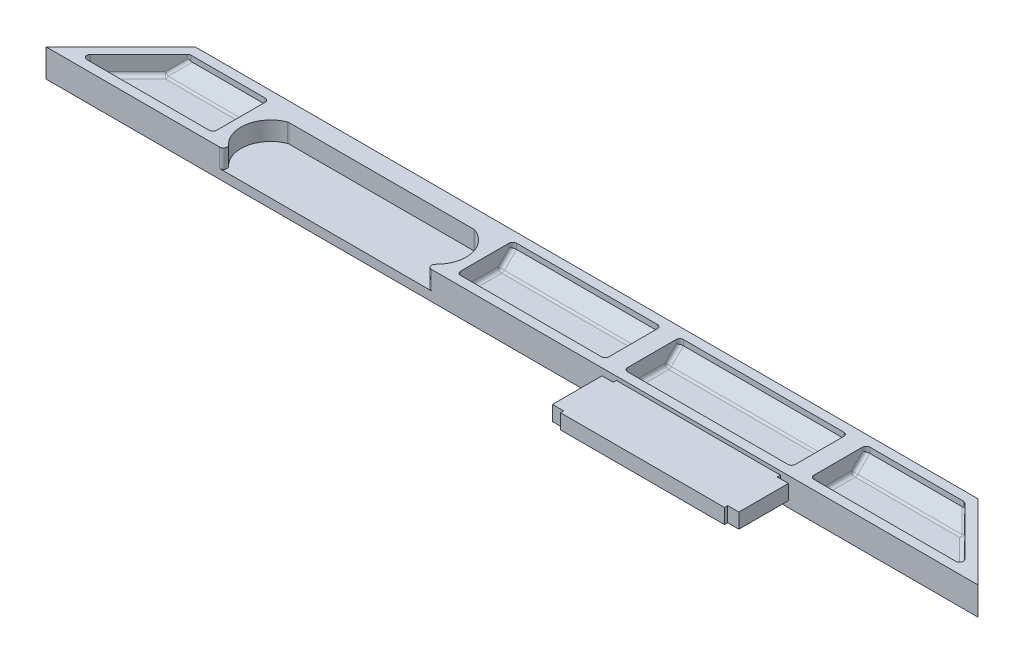
from build123d import *

# Parameters (mm, degrees)
BOSS_EXTRUDE1_DEPTH     = 3.75
SKETCH3_W               = 50
SKETCH3_H               = 15
BOSS_EXTRUDE3_DEPTH     = 4
CUT_EXTRUDE1_DEPTH      = 128.641098397
CUT_EXTRUDE1_DEPTH_BACK = 4
CHAMFER1_SIZE           = 5
SKETCH7_W               = 3
SKETCH7_H               = 0.853193318
CUT_EXTRUDE2_DEPTH      = 128.641098397
SHELL1_START            = -17.283882181
SHELL1_DEPTH            = 121.248348275
SHELL1_START_2          = -103.964466094
SHELL1_2_DEPTH          = 21.248348275
SHELL1_START_3          = -118.964466094
SHELL1_3_DEPTH          = 43.546786157
SHELL1_START_4          = -24.582320063
SHELL1_4_DEPTH          = 143.546786157
SHELL1_START_5          = -1.25
SHELL1_5_DEPTH          = 5
BOSS_EXTRUDE4_REACH     = 129.696
RIB1_REACH              = 129.696
SKETCH5_WALLS_W         = 5
SKETCH5_WALLS_H         = 272.391855782
FILLET1_R               = 1
FILLET3_R               = 1


with BuildPart() as part:
    # Sketch1 → Boss-Extrude1 (new, symmetric)
    with BuildSketch(Plane(origin=(0, 0, 0), x_dir=(1, 0, 0), z_dir=(0, 1, 0))):
        Polygon((-125, -10), (125, -10), (105, 10), (-105, 10), align=None)
    extrude(amount=BOSS_EXTRUDE1_DEPTH, both=True)

    # Sketch3 → Boss-Extrude3 (add)
    with BuildSketch(Plane(origin=(0, 2.75, 0), x_dir=(-1, 0, 0), z_dir=(0, 1, 0))):
        with Locations((-50, 17.5)):
            Rectangle(SKETCH3_W, SKETCH3_H)
    extrude(amount=-BOSS_EXTRUDE3_DEPTH)

    # Sketch4 → Cut-Extrude1 (cut, two sides: drawn at the far end of the back side and taken through both)
    with BuildSketch(Plane(origin=(0, 2.75, 0), x_dir=(-1, 0, 0), z_dir=(0, 1, 0)).offset(-CUT_EXTRUDE1_DEPTH_BACK)):
        with BuildLine():
            Line((75, 10), (25, 10))
            ThreePointArc((25, 10), (19.783882181, 2.5), (25, -5))
            Line((25, -5), (75, -5))
            ThreePointArc((75, -5), (80.216117819, 2.5), (75, 10))
        make_face()
    extrude(amount=CUT_EXTRUDE1_DEPTH + CUT_EXTRUDE1_DEPTH_BACK, mode=Mode.SUBTRACT)

    # Chamfer1
    chamfer1_edges = [part.edges().sort_by_distance(p)[0] for p in [
        (0, -3.75, -10),
    ]]
    chamfer(chamfer1_edges, length=CHAMFER1_SIZE)

    # Sketch7 → Cut-Extrude2 (cut, through all)
    with BuildSketch(Plane(origin=(0, 2.75, 0), x_dir=(-1, 0, 0), z_dir=(0, 1, 0))):
        with Locations((-73.5, 24.573403341)):
            Rectangle(SKETCH7_W, SKETCH7_H)
        with Locations((-73.5, 10.426596659)):
            Rectangle(SKETCH7_W, SKETCH7_H)
        with Locations((-26.5, 10.426596659)):
            Rectangle(SKETCH7_W, SKETCH7_H)
        with Locations((-26.5, 24.573403341)):
            Rectangle(SKETCH7_W, SKETCH7_H)
    extrude(amount=-CUT_EXTRUDE2_DEPTH, mode=Mode.SUBTRACT)

    # Shell1: read off the stored shape, not the designer's step
    # Shell1 outline → Shell1 (cut)
    with BuildSketch(Plane.YZ.offset(SHELL1_START)):
        Polygon((-1.25, 7.5), (-1.25, -3.964466094), (2.285533906, -7.5), (3.75, -7.5), (3.75, 7.5), align=None)
    extrude(amount=SHELL1_DEPTH, mode=Mode.SUBTRACT)

    # Shell1 2 outline → Shell1 2 (cut)
    with BuildSketch(Plane.YZ.offset(SHELL1_START_2)):
        Polygon((-1.25, 7.5), (-1.25, -3.964466094), (2.285533906, -7.5), (3.75, -7.5), (3.75, 7.5), align=None)
    extrude(amount=SHELL1_2_DEPTH, mode=Mode.SUBTRACT)

    # Shell1 3 outline → Shell1 3 (cut)
    with BuildSketch(Plane.YZ.offset(SHELL1_START_3)):
        Polygon((-1.25, 7.5), (-1.25, -3.964466094), (2.285533906, -7.5), (3.75, -7.5), (3.75, 7.5), align=None)
    extrude(amount=SHELL1_3_DEPTH, mode=Mode.SUBTRACT)

    # Shell1 4 outline → Shell1 4 (cut)
    with BuildSketch(Plane.YZ.offset(SHELL1_START_4)):
        Polygon((-1.25, 7.5), (-1.25, -3.964466094), (2.285533906, -7.5), (3.75, -7.5), (3.75, 7.5), align=None)
    extrude(amount=SHELL1_4_DEPTH, mode=Mode.SUBTRACT)

    # Shell1 5 outline → Shell1 5 (add)
    with BuildSketch(Plane(origin=(0, 0, 0), x_dir=(1, 0, 0), z_dir=(0, 1, 0)).offset(SHELL1_START_5)):
        Polygon((-107.5, 7.5), (-118.964466094, -3.964466094), (-118.964466094, -7.5), (-103.964466094, 7.5), align=None)
        with BuildLine():
            ThreePointArc((-75.417679937, 7.5), (-81.958045751, 1.417249055), (-81.449210475, -7.5))
            Line((-81.449210475, -7.5), (-78.461115817, -7.5))
            ThreePointArc((-78.461115817, -7.5), (-79.983065249, -0.58309426), (-75.417679937, 4.831439149))
            Line((-75.417679937, 4.831439149), (-75.417679937, 7.5))
        make_face()
        Polygon((118.964466094, -3.964466094), (107.5, 7.5), (103.964466094, 7.5), (118.964466094, -7.5), align=None)
        with BuildLine():
            ThreePointArc((-18.550789525, -7.5), (-18.041954249, 1.417249055), (-24.582320063, 7.5))
            Line((-24.582320063, 7.5), (-24.582320063, 4.831439149))
            ThreePointArc((-24.582320063, 4.831439149), (-20.016934751, -0.58309426), (-21.538884183, -7.5))
            Line((-21.538884183, -7.5), (-18.550789525, -7.5))
        make_face()
    extrude(amount=SHELL1_5_DEPTH)

    # Sketch6 → Boss-Extrude4 (add, up to next)
    with BuildSketch(Plane.XZ.offset(-3.75), mode=Mode.PRIVATE) as boss_extrude4_sk1:
        with BuildLine():
            Line((-17.283882181, -7.5), (-17.283882181, 2.500000029))
            ThreePointArc((-17.283882181, 2.500000029), (-19.302537873, -3.69005644), (-24.582320063, -7.5))
            Line((-24.582320063, -7.5), (-17.283882181, -7.5))
        make_face()
    boss_extrude4_tool1 = extrude(boss_extrude4_sk1.sketch, amount=BOSS_EXTRUDE4_REACH, mode=Mode.PRIVATE) - part.part
    # Sketch6 → Boss-Extrude4 (add, up to next)
    with BuildSketch(Plane.XZ.offset(-3.75), mode=Mode.PRIVATE) as boss_extrude4_sk2:
        with BuildLine():
            Line((-17.283882181, 2.500000029), (-17.283882181, 7.5))
            Line((-17.283882181, 7.5), (-18.550789525, 7.5))
            ThreePointArc((-18.550789525, 7.5), (-17.605535736, 5.079004387), (-17.283882181, 2.500000029))
        make_face()
    boss_extrude4_tool2 = extrude(boss_extrude4_sk2.sketch, amount=BOSS_EXTRUDE4_REACH, mode=Mode.PRIVATE) - part.part
    # Sketch6 → Boss-Extrude4 (add, up to next)
    with BuildSketch(Plane.XZ.offset(-3.75), mode=Mode.PRIVATE) as boss_extrude4_sk3:
        with BuildLine():
            Line((-82.716117819, 7.5), (-82.716117819, 2.499999956))
            ThreePointArc((-82.716117819, 2.499999956), (-82.394464273, 5.079004351), (-81.449210475, 7.5))
            Line((-81.449210475, 7.5), (-82.716117819, 7.5))
        make_face()
    boss_extrude4_tool3 = extrude(boss_extrude4_sk3.sketch, amount=BOSS_EXTRUDE4_REACH, mode=Mode.PRIVATE) - part.part
    # Sketch6 → Boss-Extrude4 (add, up to next)
    with BuildSketch(Plane.XZ.offset(-3.75), mode=Mode.PRIVATE) as boss_extrude4_sk4:
        with BuildLine():
            Line((-82.716117819, -7.5), (-75.417679937, -7.5))
            ThreePointArc((-75.417679937, -7.5), (-80.697462105, -3.69005647), (-82.716117819, 2.499999956))
            Line((-82.716117819, 2.499999956), (-82.716117819, -7.5))
        make_face()
    boss_extrude4_tool4 = extrude(boss_extrude4_sk4.sketch, amount=BOSS_EXTRUDE4_REACH, mode=Mode.PRIVATE) - part.part
    add(boss_extrude4_tool1.solids().sort_by_distance((-19.229077, 3.75, -5.202593))[0])
    add(boss_extrude4_tool2.solids().sort_by_distance((-17.659672, 3.75, 6.265582))[0])
    add(boss_extrude4_tool3.solids().sort_by_distance((-82.340328, 3.75, 6.265582))[0])
    add(boss_extrude4_tool4.solids().sort_by_distance((-80.770923, 3.75, -5.202593))[0])

    # Sketch5 walls → Rib1 (add, up to next)
    with BuildSketch(Plane.XZ.offset(-3.75), mode=Mode.PRIVATE) as rib1_sk1:
        with Locations((75, 0)):
            Rectangle(SKETCH5_WALLS_W, SKETCH5_WALLS_H)
    rib1_tool1 = extrude(rib1_sk1.sketch, amount=RIB1_REACH, mode=Mode.PRIVATE) - part.part
    # Sketch5 walls → Rib1 (add, up to next)
    with BuildSketch(Plane.XZ.offset(-3.75), mode=Mode.PRIVATE) as rib1_sk2:
        with Locations((25, 0)):
            Rectangle(SKETCH5_WALLS_W, SKETCH5_WALLS_H)
    rib1_tool2 = extrude(rib1_sk2.sketch, amount=RIB1_REACH, mode=Mode.PRIVATE) - part.part
    add(rib1_tool1.solids().sort_by_distance((75, 3.75, 0))[0])
    add(rib1_tool2.solids().sort_by_distance((25, 3.75, 0))[0])

    # Fillet1
    fillet1_edges = [part.edges().sort_by_distance(p)[0] for p in [
        (113.232233047, -1.25, 1.767766953),
        (105.732233047, 0.517766953, -5.732233047),
        (118.964466094, 1.25, 7.5),
        (103.964466094, 3.017766953, -7.5),
        (-103.964466094, 3.017766953, -7.5),
        (-105.732233047, 0.517766953, -5.732233047),
        (-113.232233047, -1.25, 1.767766953),
        (-100.840291956, -1.25, 7.5),
        (-118.964466094, 1.25, 7.5),
        (-95.108058909, -1.25, -3.964466094),
        (2.608058909, -1.25, -3.964466094),
        (-17.283882181, -1.25, 1.767766953),
        (-17.283882181, 0.517766953, -5.732233047),
        (-17.283882181, 3.017766953, -7.5),
        (2.608058909, -1.25, 7.5),
        (-17.283882181, 1.25, 7.5),
        (-82.716117819, -1.25, 1.767766953),
        (-82.716117819, 1.25, 7.5),
        (-82.716117819, 0.517766953, -5.732233047),
        (-82.716117819, 3.017766953, -7.5),
        (92.5, -1.25, -3.964466094),
        (77.5, 0.517766953, -5.732233047),
        (72.5, 0.517766953, -5.732233047),
        (98.232233047, -1.25, 7.5),
        (72.5, 1.25, 7.5),
        (77.5, -1.25, 1.767766953),
        (72.5, -1.25, 1.767766953),
        (72.5, 3.017766953, -7.5),
        (77.5, 1.25, 7.5),
        (77.5, 3.017766953, -7.5),
        (50, -1.25, -3.964466094),
        (27.5, 0.517766953, -5.732233047),
        (22.5, 0.517766953, -5.732233047),
        (50, -1.25, 7.5),
        (27.5, -1.25, 1.767766953),
        (22.5, 1.25, 7.5),
        (22.5, -1.25, 1.767766953),
        (22.5, 3.017766953, -7.5),
        (27.5, 1.25, 7.5),
        (27.5, 3.017766953, -7.5),
    ]]
    fillet(fillet1_edges, radius=FILLET1_R)

    # Fillet3
    fillet3_edges = [part.edges().sort_by_distance(p)[0] for p in [
        (-25, 1.25, 10),
        (-25, 1.25, -5),
        (-75, 1.25, -5),
        (-75, 1.25, 10),
    ]]
    fillet(fillet3_edges, radius=FILLET3_R)


solid = part.part
